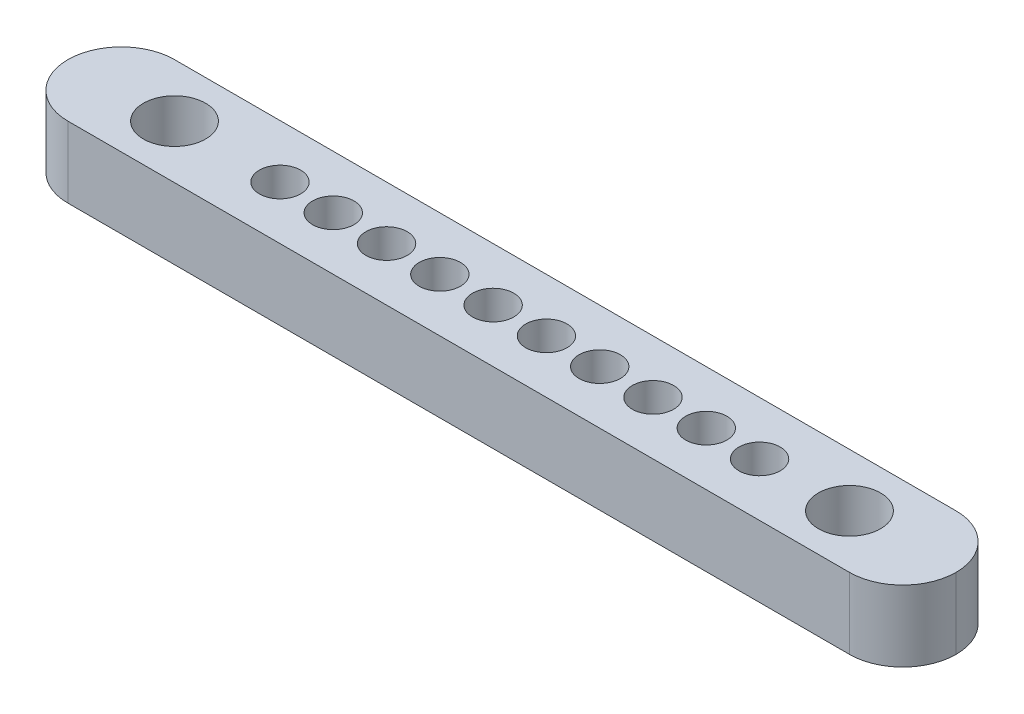
from build123d import *

# Parameters (mm, degrees)
SKETCH_1_W      = 50
SKETCH_1_H      = 6
SKETCH_1_R      = 1.75
SKETCH_1_R_2    = 1.162790698
EXTRUDE_1_DEPTH = 4
FILLET_1_R      = 3


with BuildPart() as part:
    # 草圖1 → 填料-伸長1 (new body)
    with BuildSketch(Plane(origin=(0, 0, 0), x_dir=(1, 0, 0), z_dir=(0, 1, 0))):
        Rectangle(SKETCH_1_W, SKETCH_1_H)
        with Locations(Location((-19, 0, 0), (0, 0, 270))):
            Circle(SKETCH_1_R, mode=Mode.SUBTRACT)
        with Locations(Location((19, 0, 0), (0, 0, 270))):
            Circle(SKETCH_1_R, mode=Mode.SUBTRACT)
        with Locations(Location((-13.062015504, 0, 0), (0, 0, 270))):
            Circle(SKETCH_1_R_2, mode=Mode.SUBTRACT)
        with Locations(Location((-10.062015504, 0, 0), (0, 0, 270))):
            Circle(SKETCH_1_R_2, mode=Mode.SUBTRACT)
        with Locations(Location((-7.062015504, 0, 0), (0, 0, 270))):
            Circle(SKETCH_1_R_2, mode=Mode.SUBTRACT)
        with Locations(Location((-4.062015504, 0, 0), (0, 0, 270))):
            Circle(SKETCH_1_R_2, mode=Mode.SUBTRACT)
        with Locations(Location((-1.062015504, 0, 0), (0, 0, 270))):
            Circle(SKETCH_1_R_2, mode=Mode.SUBTRACT)
        with Locations(Location((1.937984496, 0, 0), (0, 0, 270))):
            Circle(SKETCH_1_R_2, mode=Mode.SUBTRACT)
        with Locations(Location((4.937984496, 0, 0), (0, 0, 270))):
            Circle(SKETCH_1_R_2, mode=Mode.SUBTRACT)
        with Locations(Location((7.937984496, 0, 0), (0, 0, 270))):
            Circle(SKETCH_1_R_2, mode=Mode.SUBTRACT)
        with Locations(Location((10.937984496, 0, 0), (0, 0, 270))):
            Circle(SKETCH_1_R_2, mode=Mode.SUBTRACT)
        with Locations(Location((13.937984496, 0, 0), (0, 0, 270))):
            Circle(SKETCH_1_R_2, mode=Mode.SUBTRACT)
    extrude(amount=EXTRUDE_1_DEPTH)

    # 圓角1
    fillet_1_edges = [part.edges().sort_by_distance(p)[0] for p in [
        (25, 2, 3),
        (25, 2, -3),
        (-25, 2, -3),
        (-25, 2, 3),
    ]]
    fillet(fillet_1_edges, radius=FILLET_1_R - 0.0001)  # a hair under: the kernel refuses the full size


solid = part.part
